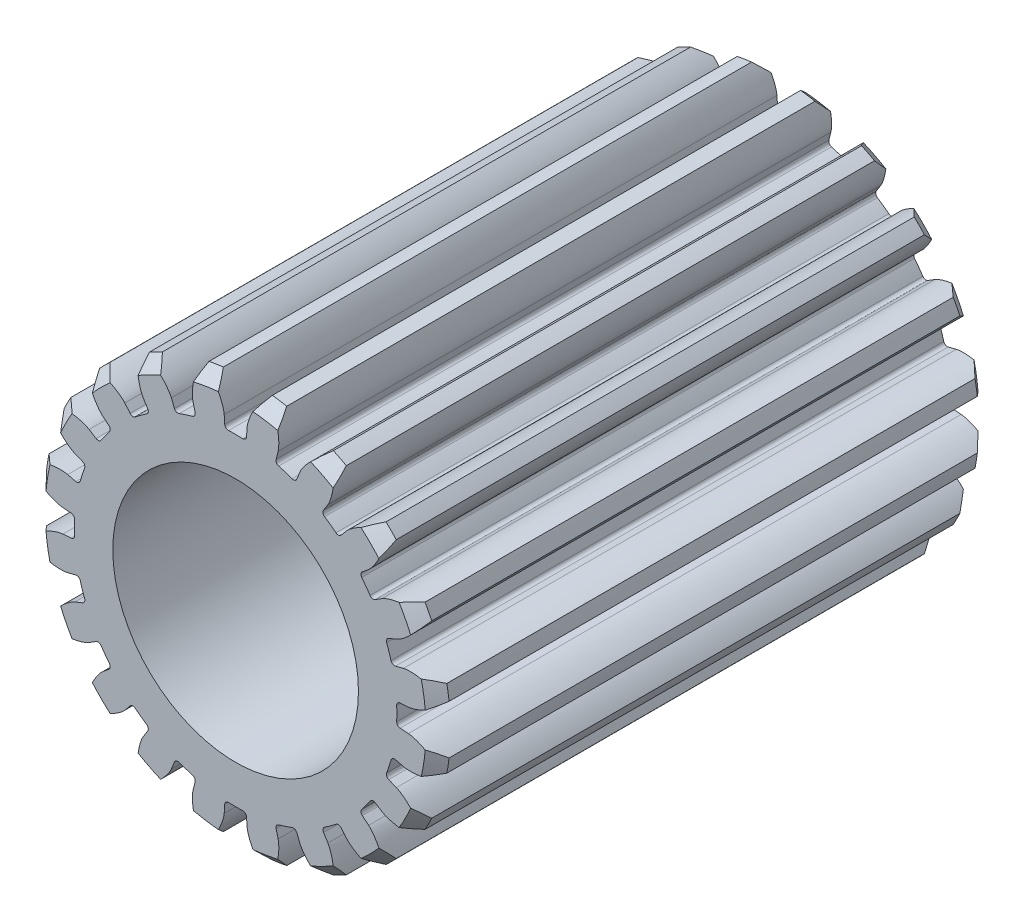
from build123d import *

# Parameters (mm, degrees)
SKETCH_1136_R                    = 16.5
EXTRUDE_1162_DEPTH               = 22.5
CHAMFER_1201_SIZE                = 1
CUT_EXTRUDE_1597_DEPTH           = 22.5
FILLET_2_R                       = 0.3
PATTERN_CIRCULAR_2_COUNT         = 20
FILLET_2_OF_PATTERN_CIRCULAR_2_R = 0.3
SKETCH_1_R                       = 10
CUT_EXTRUDE_1_DEPTH              = 51.611593172


with BuildPart() as part:
    # Sketch 1136 → Extrude 1162 (new, symmetric)
    with BuildSketch(Plane.XY):
        Circle(SKETCH_1136_R)
    extrude(amount=EXTRUDE_1162_DEPTH, both=True)

    # Chamfer 1201
    chamfer_1201_edges = [part.edges().sort_by_distance(p)[0] for p in [
        (-16.5, 0, -22.5),
        (-16.5, 0, 22.5),
    ]]
    chamfer(chamfer_1201_edges, length=CHAMFER_1201_SIZE)

    # Sketch 1282 → Cut-Extrude 1597 (cut, symmetric)
    with BuildSketch(Plane.XY):
        with BuildLine():
            ThreePointArc((-0.866863845, 13.096341935), (0, 13.125), (0.866863845, 13.096341935))
            Line((0.866863845, 13.096341935), (0.930954924, 14.064612429))
            add(Edge.make_bspline(
                [(0.930954924, 14.064612429), (0.932726214, 14.091372594), (0.937908738, 14.144710911), (0.95473225, 14.250662097), (0.999280832, 14.449809584), (1.078975233, 14.712136653), (1.267837764, 15.196707939), (1.51875371, 15.672188068), (1.754786821, 16.043501777), (1.954288101, 16.322157943), (1.995827161, 16.378848371)],
                knots=[0, 0, 0, 0, 0, 0.001401017, 0.002802034, 0.005604068, 0.010661158, 0.015718248, 0.029959916, 0.033634156, 0.033634156, 0.033634156, 0.033634156, 0.033634156], degree=4))
            ThreePointArc((1.995827161, 16.378848371), (0, 16.5), (-1.995827161, 16.378848371))
            add(Edge.make_bspline(
                [(-0.930954924, 14.064612429), (-0.932726214, 14.091372594), (-0.937908738, 14.144710911), (-0.95473225, 14.250662097), (-0.999280832, 14.449809584), (-1.078975233, 14.712136653), (-1.267837764, 15.196707939), (-1.51875371, 15.672188068), (-1.754786821, 16.043501777), (-1.954288101, 16.322157943), (-1.995827161, 16.378848371)],
                knots=[0, 0, 0, 0, 0, 0.001401017, 0.002802034, 0.005604068, 0.010661158, 0.015718248, 0.029959916, 0.033634156, 0.033634156, 0.033634156, 0.033634156, 0.033634156], degree=4))
            Line((-0.930954924, 14.064612429), (-0.866863845, 13.096341935))
        make_face()
    cut_extrude_1597 = extrude(amount=CUT_EXTRUDE_1597_DEPTH, both=True, mode=Mode.SUBTRACT)

    # 圆角2
    fillet_2_edges = [part.edges().sort_by_distance(p)[0] for p in [
        (0.866863845, 13.096341935, 0),
        (-0.866863845, 13.096341935, 0),
    ]]
    fillet(fillet_2_edges, radius=FILLET_2_R)

    # 圆周阵列2: Cut-Extrude 1597 ×20 about axis
    pattern_circular_2_axis = Axis((0, 0, 22.5), (0, 0, -1))
    for i in range(1, PATTERN_CIRCULAR_2_COUNT):
        add(cut_extrude_1597.rotate(pattern_circular_2_axis, i * 360 / PATTERN_CIRCULAR_2_COUNT), mode=Mode.SUBTRACT)

    # 圆角2 of 圆周阵列2
    fillet_2_of_pattern_circular_2_edges = [part.edges().sort_by_distance(p)[0] for p in [
        (4.871428731, 12.187485677, 0),
        (3.222555714, 12.723236997, 0),
        (8.399144231, 10.085633406, 0),
        (6.996529066, 11.104692973, 0),
        (11.104692973, 6.996529066, 0),
        (10.085633406, 8.399144231, 0),
        (12.723236997, 3.222555714, 0),
        (12.187485677, 4.871428731, 0),
        (13.096341935, -0.866863845, 0),
        (13.096341935, 0.866863845, 0),
        (12.187485677, -4.871428731, 0),
        (12.723236997, -3.222555714, 0),
        (10.085633406, -8.399144231, 0),
        (11.104692973, -6.996529066, 0),
        (6.996529066, -11.104692973, 0),
        (8.399144231, -10.085633406, 0),
        (3.222555714, -12.723236997, 0),
        (4.871428731, -12.187485677, 0),
        (-0.866863845, -13.096341935, 0),
        (0.866863845, -13.096341935, 0),
        (-4.871428731, -12.187485677, 0),
        (-3.222555714, -12.723236997, 0),
        (-8.399144231, -10.085633406, 0),
        (-6.996529066, -11.104692973, 0),
        (-11.104692973, -6.996529066, 0),
        (-10.085633406, -8.399144231, 0),
        (-12.723236997, -3.222555714, 0),
        (-12.187485677, -4.871428731, 0),
        (-13.096341935, 0.866863845, 0),
        (-13.096341935, -0.866863845, 0),
        (-12.187485677, 4.871428731, 0),
        (-12.723236997, 3.222555714, 0),
        (-10.085633406, 8.399144231, 0),
        (-11.104692973, 6.996529066, 0),
        (-6.996529066, 11.104692973, 0),
        (-8.399144231, 10.085633406, 0),
        (-3.222555714, 12.723236997, 0),
        (-4.871428731, 12.187485677, 0),
    ]]
    fillet(fillet_2_of_pattern_circular_2_edges, radius=FILLET_2_OF_PATTERN_CIRCULAR_2_R)

    # 草图1 → 切除-拉伸1 (cut, through all)
    with BuildSketch(Plane.XY.offset(22.5)):
        Circle(SKETCH_1_R)
    extrude(amount=-CUT_EXTRUDE_1_DEPTH, mode=Mode.SUBTRACT)


solid = part.part
